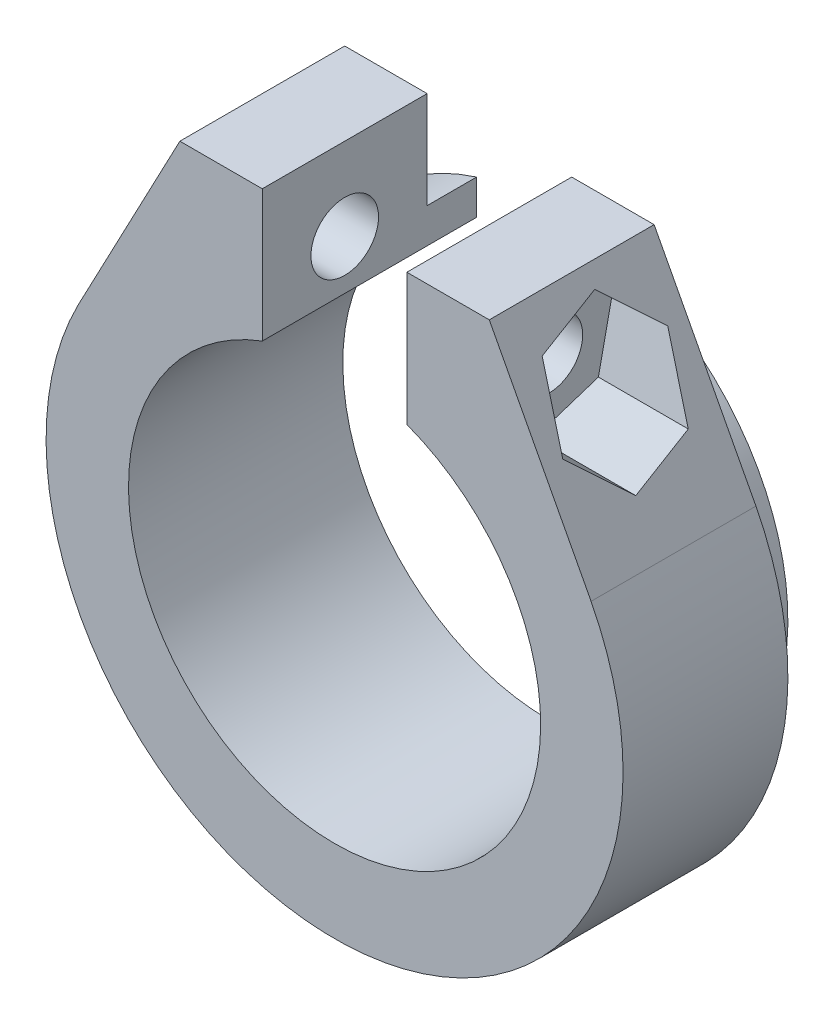
from build123d import *
from build123d.topology import SkipClean

# Parameters (mm, degrees)
BOSS_EXTRUDE1_DEPTH     = 10
CUT_EXTRUDE1_DEPTH      = 29.188093475
CUT_EXTRUDE1_DEPTH_BACK = 29.188093475
SKETCH4_R               = 2.05
CUT_EXTRUDE2_OUTLINE_W  = 1.4
CUT_EXTRUDE2_OUTLINE_H  = 5.870544518
CUT_EXTRUDE3_START      = 20
CUT_EXTRUDE3_DEPTH      = 12
BOSS_EXTRUDE2_START     = 3
SKETCH8_R               = 14.5
SKETCH8_R_2             = 12.5
BOSS_EXTRUDE2_DEPTH     = 3
CUT_EXTRUDE7_DEPTH      = 3


# Read off the part's stored shape, not the designer's step: Cut-Extrude2
with BuildPart() as part:
    # Sketch1 → Boss-Extrude1 (new body)
    with BuildSketch(Plane.XY):
        with BuildLine():
            Line((-15.560899439, 8.006772674), (-9.384542241, 19.705801525))
            Line((-9.384542241, 19.705801525), (-4.384542241, 19.705801525))
            Line((-4.384542241, 19.705801525), (-4.384542241, 16.705801525))
            Line((-4.384542241, 16.705801525), (-4.384542241, 11.705801525))
            ThreePointArc((-4.384542241, 11.705801525), (0, -12.5), (4.384542241, 11.705801525))
            Line((4.384542241, 11.705801525), (4.384542241, 16.705801525))
            Line((4.384542241, 16.705801525), (4.384542241, 19.705801525))
            Line((4.384542241, 19.705801525), (9.384542241, 19.705801525))
            Line((9.384542241, 19.705801525), (15.560899439, 8.006772674))
            ThreePointArc((15.560899439, 8.006772674), (0, -17.5), (-15.560899439, 8.006772674))
        make_face()
    extrude(amount=BOSS_EXTRUDE1_DEPTH)

    # Sketch4 → Cut-Extrude1 (cut, two sides: drawn at the far end of the back side and taken through both)
    with BuildSketch(Plane(origin=(0, 0, 0), x_dir=(0, 0, -1), z_dir=(1, 0, 0)).offset(-CUT_EXTRUDE1_DEPTH_BACK)):
        with Locations(Location((-5, 14.705801525, 0), (0, 0, 90))):
            Circle(SKETCH4_R)
    extrude(amount=CUT_EXTRUDE1_DEPTH + CUT_EXTRUDE1_DEPTH_BACK, mode=Mode.SUBTRACT)

    # Cut-Extrude2 outline → Cut-Extrude2 (revolve, cut)
    with BuildSketch(Plane(origin=(0, 14.705801525, 5), x_dir=(0, 1, 0), z_dir=(0, 0, -1))):
        with Locations((2.75, -10.935272259)):
            Rectangle(CUT_EXTRUDE2_OUTLINE_W, CUT_EXTRUDE2_OUTLINE_H)
    revolve(axis=Axis((0, 14.705801525, 5), (1, 0, 0)), mode=Mode.SUBTRACT)

    # Sketch6 → Cut-Extrude3 (cut)
    with BuildSketch(Plane(origin=(0, 0, 0), x_dir=(0, 0, -1), z_dir=(1, 0, 0)).offset(CUT_EXTRUDE3_START)):
        Polygon((-1.996012472, 12.00221275), (-1.156629675, 15.955536649), (-4.160617203, 18.659125424), (-8.003987528, 17.4093903), (-8.843370325, 13.456066401), (-5.839382797, 10.752477625), align=None)
    extrude(amount=-CUT_EXTRUDE3_DEPTH, mode=Mode.SUBTRACT)

    # Sketch8 → Boss-Extrude2 (add)
    with SkipClean():  # the faces are left unmerged after this step: merging them gives an invalid solid
        with BuildSketch(Plane(origin=(0, 0, 0), x_dir=(-1, 0, 0), z_dir=(0, 0, -1)).offset(BOSS_EXTRUDE2_START)):
            with Locations(Location((0, 0, 0), (0, 0, 107.600741317))):
                Circle(SKETCH8_R)
            Circle(SKETCH8_R_2, mode=Mode.SUBTRACT)
        extrude(amount=-BOSS_EXTRUDE2_DEPTH)

    # Sketch9 → Cut-Extrude7 (cut)
    with BuildSketch(Plane.XY):
        Polygon((-4.384542241, 11.705801525), (-4.384542241, 13.821207955), (0.563137908, 18.768888104), (4.384542241, 13.821207955), (4.384542241, 11.705801525), align=None)
    extrude(amount=-CUT_EXTRUDE7_DEPTH, mode=Mode.SUBTRACT)


solid = part.part
